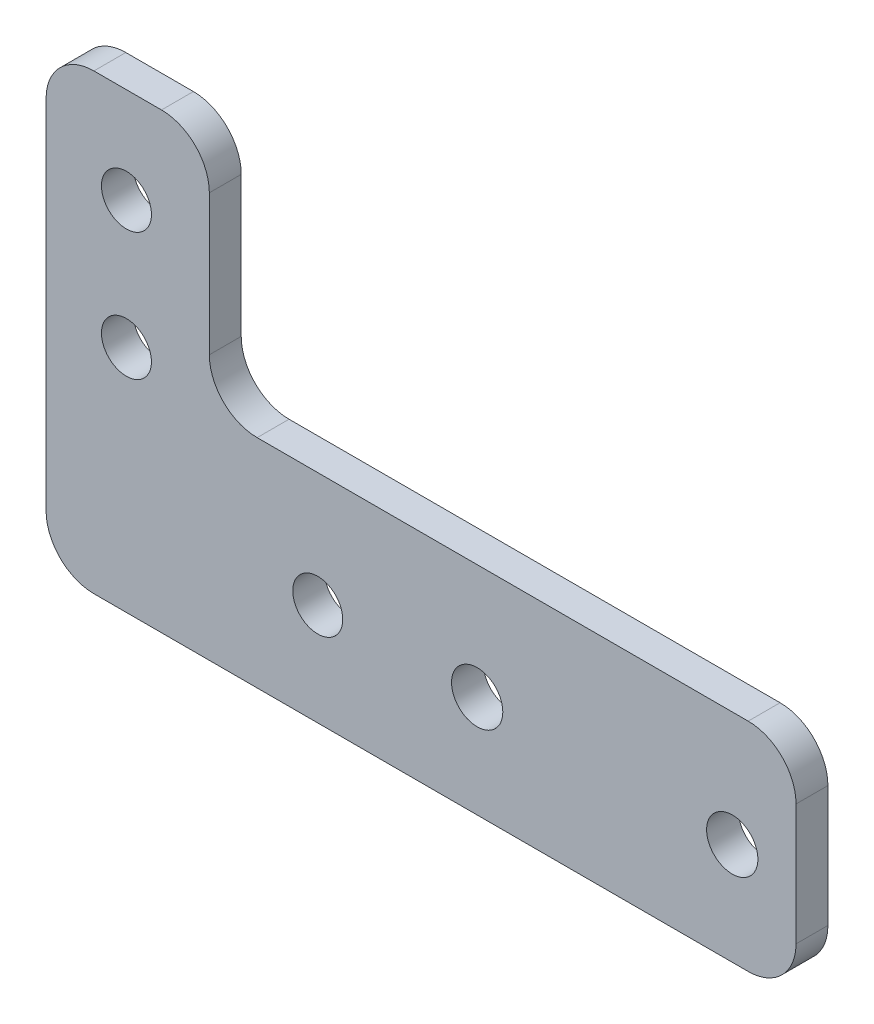
from build123d import *

# Parameters (mm, degrees)
SKETCH1_R           = 2.4892
SKETCH1_R_2         = 2.5527
BOSS_EXTRUDE1_DEPTH = 3.175
FILLET1_R           = 4.7625


with BuildPart() as part:
    # Sketch1 → Boss-Extrude1 (new body)
    with BuildSketch(Plane.XY):
        Polygon((-33.401, 23.8125), (-33.401, -21.2725), (41.275, -21.2725), (41.275, 0.3175), (-17.145, 0.3175), (-17.145, 23.8125), align=None)
        with Locations((-6.35, -11.1125)):
            Circle(SKETCH1_R, mode=Mode.SUBTRACT)
        with Locations((9.525, -11.1125)):
            Circle(SKETCH1_R_2, mode=Mode.SUBTRACT)
        with Locations((34.925, -11.1125)):
            Circle(SKETCH1_R_2, mode=Mode.SUBTRACT)
        with Locations((-25.4, 1.5875)):
            Circle(SKETCH1_R, mode=Mode.SUBTRACT)
        with Locations((-25.4, 14.2875)):
            Circle(SKETCH1_R, mode=Mode.SUBTRACT)
    extrude(amount=BOSS_EXTRUDE1_DEPTH)

    # Fillet1
    fillet1_edges = [part.edges().sort_by_distance(p)[0] for p in [
        (-33.401, 23.8125, 1.5875),
        (-17.145, 23.8125, 1.5875),
        (-17.145, 0.3175, 1.5875),
        (41.275, 0.3175, 1.5875),
        (41.275, -21.2725, 1.5875),
        (-33.401, -21.2725, 1.5875),
    ]]
    fillet(fillet1_edges, radius=FILLET1_R)


solid = part.part
